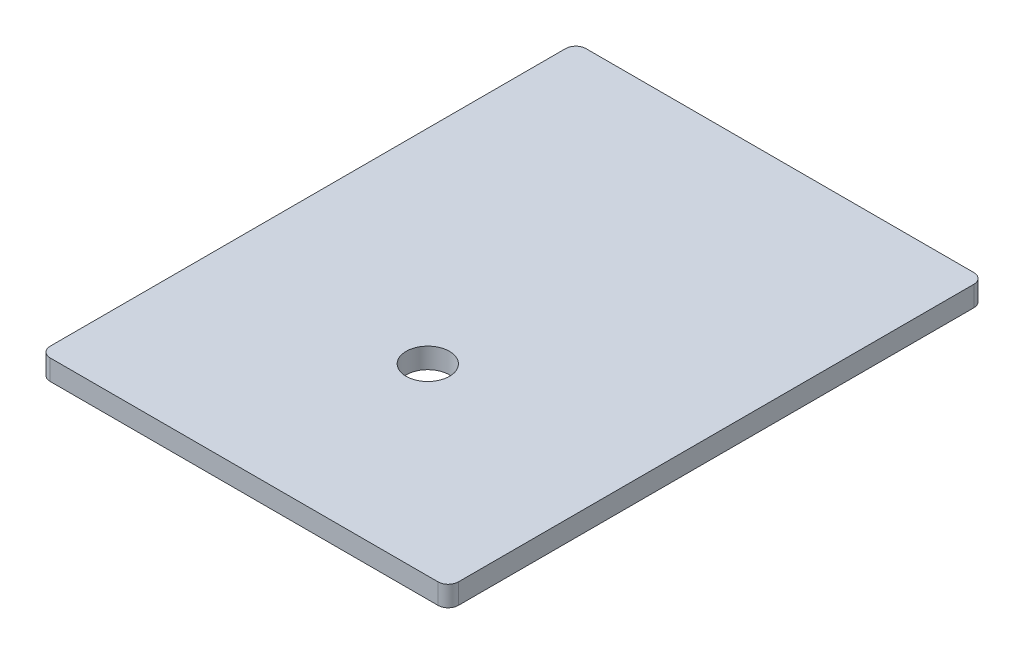
from build123d import *

# Parameters (mm, degrees)
IZIM1_W               = 160
IZIM1_H               = 210
TABAN_FLAN_1_DEPTH    = 8
K_ELERI_START         = -8
K_ELERI_K_R1_DEPTH    = 8
IZIM6_R               = 8.5
KES_EKSTR_ZYON1_DEPTH = 10


# Read off the part's stored shape, not the designer's step: Köşeleri kır1
# Sheet-metal steps are written as plain solids
with BuildPart() as part:
    # Çizim1 → Taban-Flanş1 (new body)
    with BuildSketch(Plane(origin=(0, 0, 0), x_dir=(1, 0, 0), z_dir=(0, 1, 0))):
        with Locations((0, 105)):
            Rectangle(IZIM1_W, IZIM1_H)
    extrude(amount=-TABAN_FLAN_1_DEPTH)

    # Köşeleri kır1 outline → Köşeleri kır1 (cut)
    with BuildSketch(Plane(origin=(0, 0, 0), x_dir=(1, 0, 0), z_dir=(0, 1, 0)).offset(K_ELERI_START)):
        with BuildLine():
            ThreePointArc((-80, 206), (-78.828427125, 208.828427125), (-76, 210))
            Line((-76, 210), (-80, 210))
            Line((-80, 210), (-80, 206))
        make_face()
        with BuildLine():
            Line((80, 210), (76, 210))
            ThreePointArc((76, 210), (78.828427125, 208.828427125), (80, 206))
            Line((80, 206), (80, 210))
        make_face()
        with BuildLine():
            ThreePointArc((-76, 0), (-78.828427125, 1.171572875), (-80, 4))
            Line((-80, 4), (-80, 0))
            Line((-80, 0), (-76, 0))
        make_face()
        with BuildLine():
            Line((80, 0), (80, 4))
            ThreePointArc((80, 4), (78.828427125, 1.171572875), (76, 0))
            Line((76, 0), (80, 0))
        make_face()
    extrude(amount=K_ELERI_K_R1_DEPTH, mode=Mode.SUBTRACT)

    # Çizim6 → Kes-Ekstrüzyon1 (cut)
    with BuildSketch(Plane(origin=(0, 0, 0), x_dir=(1, 0, 0), z_dir=(0, 1, 0))):
        with Locations(Location((0, 72, 0), (0, 0, 270))):
            Circle(IZIM6_R)
    extrude(amount=-KES_EKSTR_ZYON1_DEPTH, mode=Mode.SUBTRACT)


solid = part.part
